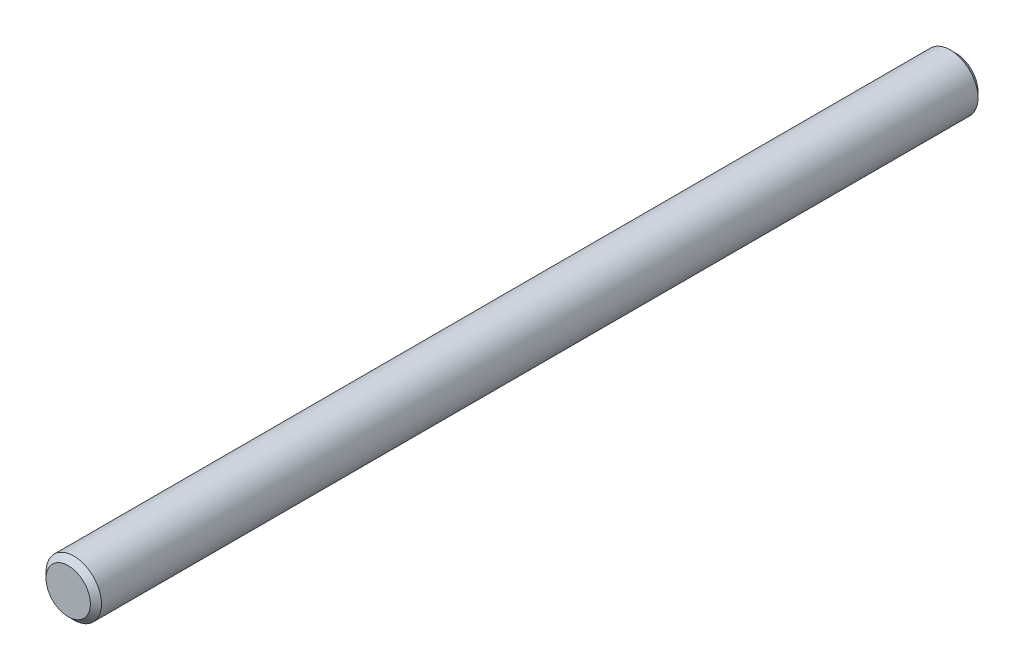
from build123d import *

# Parameters (mm, degrees)
SKETCH3_R           = 1.5875
BOSS_EXTRUDE1_DEPTH = 25.4
CHAMFER1_SIZE       = 0.3175


with BuildPart() as part:
    # Sketch3 → Boss-Extrude1 (new, symmetric)
    with BuildSketch(Plane.XY):
        Circle(SKETCH3_R)
    extrude(amount=BOSS_EXTRUDE1_DEPTH, both=True)

    # Chamfer1
    chamfer1_edges = [part.edges().sort_by_distance(p)[0] for p in [
        (-1.5875, 0, -25.4),
        (-1.5875, 0, 25.4),
    ]]
    chamfer(chamfer1_edges, length=CHAMFER1_SIZE)


solid = part.part
